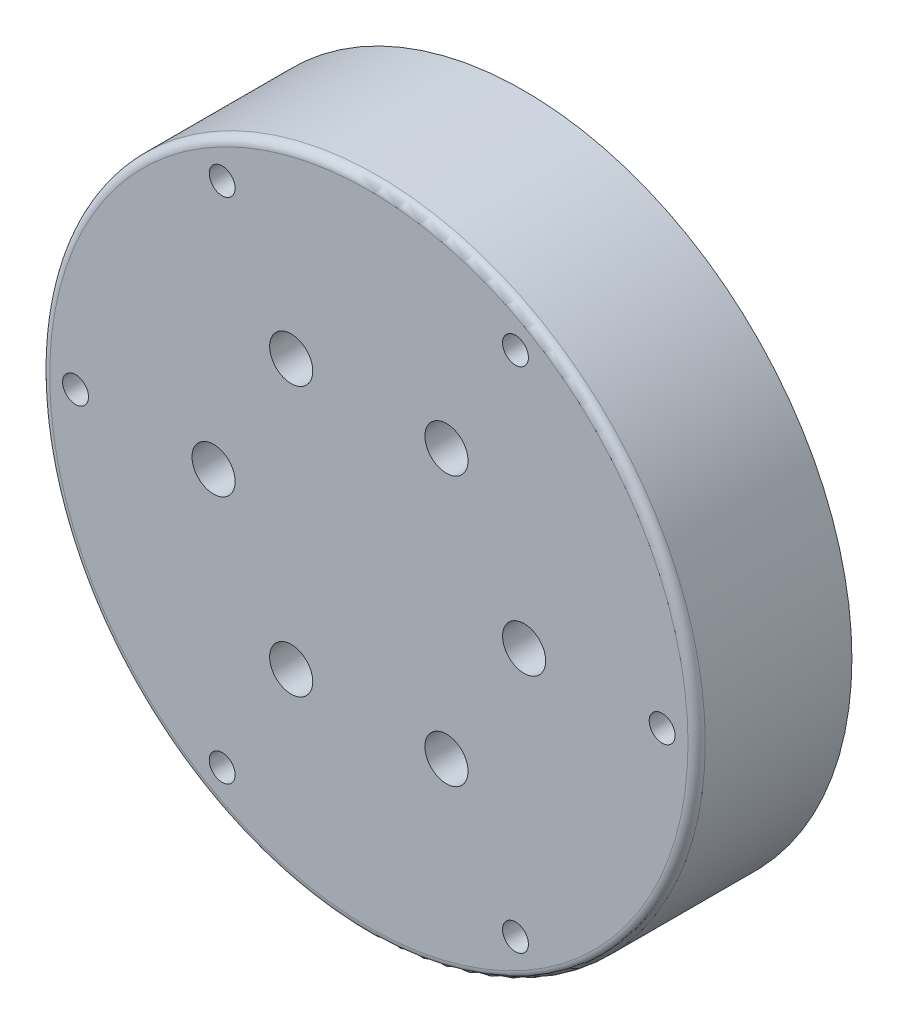
from build123d import *

# Parameters (mm, degrees)
SKETCH_1_R          = 38
EXTRUDE_1_DEPTH     = 18
CUT_EXTRUDE_1_REACH = 58.675
SKETCH_2_R          = 1.5
CUT_EXTRUDE_2_DEPTH = 12.5
FILLET_1_R          = 1
CUT_EXTRUDE_7_REACH = 79.414
SKETCH_6_W          = 20
SKETCH_6_H          = 4
CUT_EXTRUDE_8_REACH = 58.675
SKETCH_7_R          = 2.5


with BuildPart() as part:
    # Эскиз1 → Бобышка-Вытянуть1 (new body)
    with BuildSketch(Plane.XY):
        Circle(SKETCH_1_R)
    extrude(amount=EXTRUDE_1_DEPTH)

    # Эскиз2 → Вырез-Вытянуть1 (cut, up to next)
    with BuildSketch(Plane.XY.offset(18), mode=Mode.PRIVATE) as cut_extrude_1_sk1:
        with Locations((-34, 0)):
            Circle(SKETCH_2_R)
    cut_extrude_1_tool1 = extrude(cut_extrude_1_sk1.sketch, amount=-CUT_EXTRUDE_1_REACH, mode=Mode.PRIVATE) & part.part
    # Эскиз2 → Вырез-Вытянуть1 (cut, up to next)
    with BuildSketch(Plane.XY.offset(18), mode=Mode.PRIVATE) as cut_extrude_1_sk2:
        with Locations((-17, 29.444863729)):
            Circle(SKETCH_2_R)
    cut_extrude_1_tool2 = extrude(cut_extrude_1_sk2.sketch, amount=-CUT_EXTRUDE_1_REACH, mode=Mode.PRIVATE) & part.part
    # Эскиз2 → Вырез-Вытянуть1 (cut, up to next)
    with BuildSketch(Plane.XY.offset(18), mode=Mode.PRIVATE) as cut_extrude_1_sk3:
        with Locations((17, 29.444863729)):
            Circle(SKETCH_2_R)
    cut_extrude_1_tool3 = extrude(cut_extrude_1_sk3.sketch, amount=-CUT_EXTRUDE_1_REACH, mode=Mode.PRIVATE) & part.part
    # Эскиз2 → Вырез-Вытянуть1 (cut, up to next)
    with BuildSketch(Plane.XY.offset(18), mode=Mode.PRIVATE) as cut_extrude_1_sk4:
        with Locations((34, 0)):
            Circle(SKETCH_2_R)
    cut_extrude_1_tool4 = extrude(cut_extrude_1_sk4.sketch, amount=-CUT_EXTRUDE_1_REACH, mode=Mode.PRIVATE) & part.part
    # Эскиз2 → Вырез-Вытянуть1 (cut, up to next)
    with BuildSketch(Plane.XY.offset(18), mode=Mode.PRIVATE) as cut_extrude_1_sk5:
        with Locations((17, -29.444863729)):
            Circle(SKETCH_2_R)
    cut_extrude_1_tool5 = extrude(cut_extrude_1_sk5.sketch, amount=-CUT_EXTRUDE_1_REACH, mode=Mode.PRIVATE) & part.part
    # Эскиз2 → Вырез-Вытянуть1 (cut, up to next)
    with BuildSketch(Plane.XY.offset(18), mode=Mode.PRIVATE) as cut_extrude_1_sk6:
        with Locations((-17, -29.444863729)):
            Circle(SKETCH_2_R)
    cut_extrude_1_tool6 = extrude(cut_extrude_1_sk6.sketch, amount=-CUT_EXTRUDE_1_REACH, mode=Mode.PRIVATE) & part.part
    add(cut_extrude_1_tool1.solids().sort_by_distance((-34, 0, 18))[0], mode=Mode.SUBTRACT)
    add(cut_extrude_1_tool2.solids().sort_by_distance((-17, 29.444864, 18))[0], mode=Mode.SUBTRACT)
    add(cut_extrude_1_tool3.solids().sort_by_distance((17, 29.444864, 18))[0], mode=Mode.SUBTRACT)
    add(cut_extrude_1_tool4.solids().sort_by_distance((34, 0, 18))[0], mode=Mode.SUBTRACT)
    add(cut_extrude_1_tool5.solids().sort_by_distance((17, -29.444864, 18))[0], mode=Mode.SUBTRACT)
    add(cut_extrude_1_tool6.solids().sort_by_distance((-17, -29.444864, 18))[0], mode=Mode.SUBTRACT)

    # Эскиз3 → Вырез-Вытянуть2 (cut)
    with BuildSketch(Plane(origin=(0, 0, 0), x_dir=(-1, 0, 0), z_dir=(0, 0, -1))):
        with BuildLine():
            Line((-13.076696831, -27), (13.076696831, -27))
            ThreePointArc((13.076696831, -27), (0, 30), (-13.076696831, -27))
        make_face()
    extrude(amount=-CUT_EXTRUDE_2_DEPTH, mode=Mode.SUBTRACT)

    # Скругление1
    fillet_1_edges = [part.edges().sort_by_distance(p)[0] for p in [
        (-38, 0, 18),
    ]]
    fillet(fillet_1_edges, radius=FILLET_1_R)

    # Эскиз6 → Вырез-Вытянуть7 (cut, up to next)
    with BuildSketch(Plane(origin=(0, -27, 0), x_dir=(1, 0, 0), z_dir=(0, 1, 0)), mode=Mode.PRIVATE) as cut_extrude_7_sk1:
        with Locations((0, -10.5)):
            Rectangle(SKETCH_6_W, SKETCH_6_H)
    cut_extrude_7_tool1 = extrude(cut_extrude_7_sk1.sketch, amount=-CUT_EXTRUDE_7_REACH, mode=Mode.PRIVATE) & part.part
    add(cut_extrude_7_tool1.solids().sort_by_distance((0, -27, 10.5))[0], mode=Mode.SUBTRACT)

    # Эскиз7 → Вырез-Вытянуть8 (cut, up to next)
    with BuildSketch(Plane.XY.offset(18), mode=Mode.PRIVATE) as cut_extrude_8_sk1:
        with Locations((-18, 0)):
            Circle(SKETCH_7_R)
    cut_extrude_8_tool1 = extrude(cut_extrude_8_sk1.sketch, amount=-CUT_EXTRUDE_8_REACH, mode=Mode.PRIVATE) & part.part
    # Эскиз7 → Вырез-Вытянуть8 (cut, up to next)
    with BuildSketch(Plane.XY.offset(18), mode=Mode.PRIVATE) as cut_extrude_8_sk2:
        with Locations((-9, 15.588457268)):
            Circle(SKETCH_7_R)
    cut_extrude_8_tool2 = extrude(cut_extrude_8_sk2.sketch, amount=-CUT_EXTRUDE_8_REACH, mode=Mode.PRIVATE) & part.part
    # Эскиз7 → Вырез-Вытянуть8 (cut, up to next)
    with BuildSketch(Plane.XY.offset(18), mode=Mode.PRIVATE) as cut_extrude_8_sk3:
        with Locations((9, 15.588457268)):
            Circle(SKETCH_7_R)
    cut_extrude_8_tool3 = extrude(cut_extrude_8_sk3.sketch, amount=-CUT_EXTRUDE_8_REACH, mode=Mode.PRIVATE) & part.part
    # Эскиз7 → Вырез-Вытянуть8 (cut, up to next)
    with BuildSketch(Plane.XY.offset(18), mode=Mode.PRIVATE) as cut_extrude_8_sk4:
        with Locations((18, 0)):
            Circle(SKETCH_7_R)
    cut_extrude_8_tool4 = extrude(cut_extrude_8_sk4.sketch, amount=-CUT_EXTRUDE_8_REACH, mode=Mode.PRIVATE) & part.part
    # Эскиз7 → Вырез-Вытянуть8 (cut, up to next)
    with BuildSketch(Plane.XY.offset(18), mode=Mode.PRIVATE) as cut_extrude_8_sk5:
        with Locations((9, -15.588457268)):
            Circle(SKETCH_7_R)
    cut_extrude_8_tool5 = extrude(cut_extrude_8_sk5.sketch, amount=-CUT_EXTRUDE_8_REACH, mode=Mode.PRIVATE) & part.part
    # Эскиз7 → Вырез-Вытянуть8 (cut, up to next)
    with BuildSketch(Plane.XY.offset(18), mode=Mode.PRIVATE) as cut_extrude_8_sk6:
        with Locations((-9, -15.588457268)):
            Circle(SKETCH_7_R)
    cut_extrude_8_tool6 = extrude(cut_extrude_8_sk6.sketch, amount=-CUT_EXTRUDE_8_REACH, mode=Mode.PRIVATE) & part.part
    add(cut_extrude_8_tool1.solids().sort_by_distance((-18, 0, 18))[0], mode=Mode.SUBTRACT)
    add(cut_extrude_8_tool2.solids().sort_by_distance((-9, 15.588457, 18))[0], mode=Mode.SUBTRACT)
    add(cut_extrude_8_tool3.solids().sort_by_distance((9, 15.588457, 18))[0], mode=Mode.SUBTRACT)
    add(cut_extrude_8_tool4.solids().sort_by_distance((18, 0, 18))[0], mode=Mode.SUBTRACT)
    add(cut_extrude_8_tool5.solids().sort_by_distance((9, -15.588457, 18))[0], mode=Mode.SUBTRACT)
    add(cut_extrude_8_tool6.solids().sort_by_distance((-9, -15.588457, 18))[0], mode=Mode.SUBTRACT)


solid = part.part
